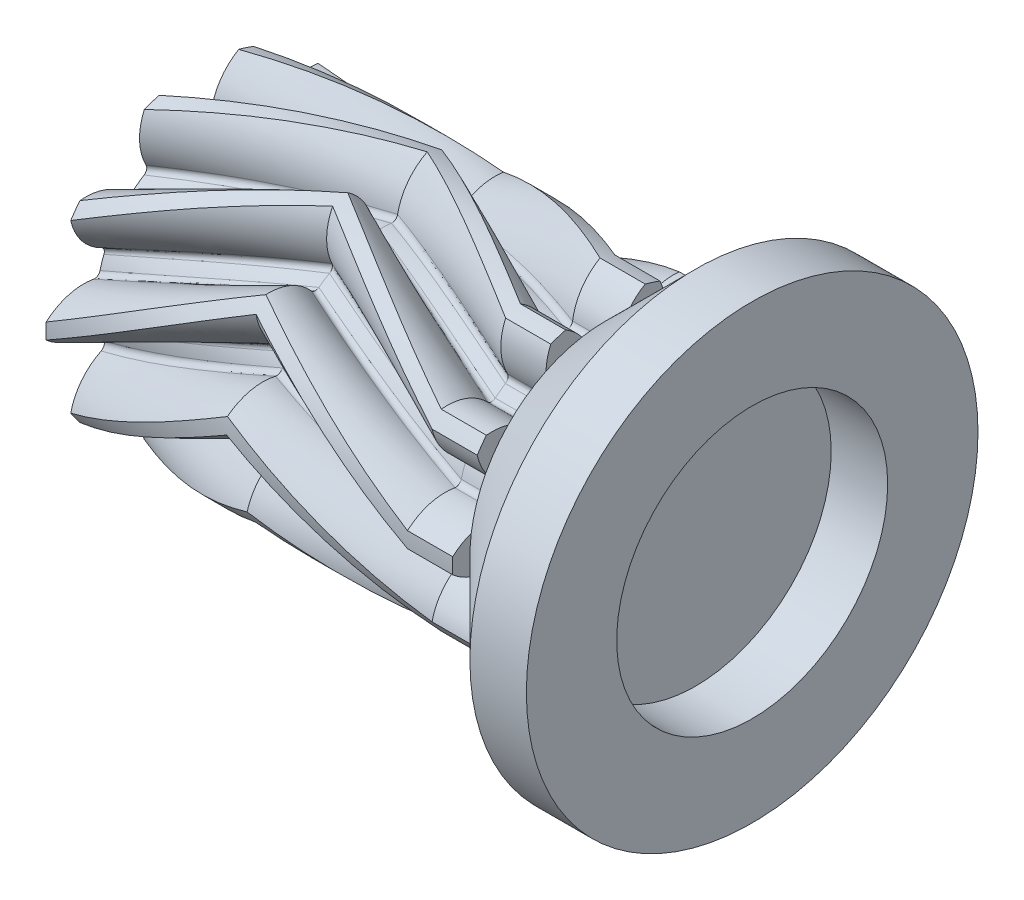
from build123d import *

# Parameters (mm, degrees)
BASPROSKE_W            = 4
BASPROSKE_H            = 3.386751346
TOOTHCUTLH_PITCH       = 36.857324629
TOOTHCUTLH_HEIGHT      = 4
TOOTHCUTLH_RADIUS      = 3.386751346
TOOTHCUTLH_START_ANGLE = -90
TEETHCUTSLH_COUNT      = 10
TEETHCUTSLH_ANGLE      = 324
BORSKE_R               = 1.5
BORE_DEPTH             = 62.5000025
BOSS_EXTRUDE2_DEPTH    = 8
BOSS_EXTRUDE5_START    = 1
BOSS_EXTRUDE5_DEPTH    = 1
SKETCH5_R              = 3
BOSS_EXTRUDE3_DEPTH    = 2
BOSS_EXTRUDE3_DRAFT    = -45
SKETCH6_R              = 5
SKETCH6_R_2            = 3
BOSS_EXTRUDE4_DEPTH    = 1.25


with BuildPart() as part:
    # BasProSke → Base-Revolve (revolve)
    with BuildSketch(Plane(origin=(0, 0, 0), x_dir=(1, 0, 0), z_dir=(0, 1, 0)), mode=Mode.PRIVATE) as base_revolve_sk:
        with Locations((2, 1.693375673)):
            Rectangle(BASPROSKE_W, BASPROSKE_H)
    revolve(base_revolve_sk.sketch.rotate(Axis((-10, 0, 0), (1, 0, 0)), 180), axis=Axis((-10, 0, 0), (1, 0, 0)))

    # ToothCutLH: sweep along a helix
    with BuildLine() as toothcutlh_path:
        add(Helix(TOOTHCUTLH_PITCH, TOOTHCUTLH_HEIGHT, TOOTHCUTLH_RADIUS, center=(0, 0, 0), direction=(1, 0, 0), lefthand=True, mode=Mode.PRIVATE).rotate(Axis((0, 0, 0), (1, 0, 0)), TOOTHCUTLH_START_ANGLE))
    # TooCutSkeRH<3> → ToothCutLH (sweep, cut)
    with BuildSketch(Plane(origin=(0, 0, 0), x_dir=(0, 0, -1), z_dir=(1, 0, 0))):
        with BuildLine():
            ThreePointArc((0.140530227, 2.257381316), (0, 2.261751346), (-0.140530227, 2.257381316))
            ThreePointArc((-0.140530227, 2.257381316), (-0.227997567, 2.28549718), (-0.273122261, 2.365527171))
            ThreePointArc((-0.273122261, 2.365527171), (-0.516553633, 2.94835954), (-1.013858929, 3.337769151))
            ThreePointArc((-1.013858929, 3.337769151), (0, 3.488353886), (1.013858929, 3.337769151))
            ThreePointArc((1.013858929, 3.337769151), (0.516553633, 2.94835954), (0.273122261, 2.365527171))
            ThreePointArc((0.273122261, 2.365527171), (0.227997567, 2.28549718), (0.140530227, 2.257381316))
        make_face()
    toothcutlh = sweep(path=toothcutlh_path.line, is_frenet=True, mode=Mode.SUBTRACT)

    # TeethCutsLH: ToothCutLH ×10 about axis
    teethcutslh_axis = Axis((-10, 0, 0), (1, 0, 0))
    for i in range(1, TEETHCUTSLH_COUNT):
        add(toothcutlh.rotate(teethcutslh_axis, i * TEETHCUTSLH_ANGLE / (TEETHCUTSLH_COUNT - 1)), mode=Mode.SUBTRACT)

    # BorSke → Bore (cut, symmetric)
    with BuildSketch(Plane(origin=(0, 0, 0), x_dir=(0, 0, -1), z_dir=(1, 0, 0))):
        with Locations(Location((0, 0, 0), (0, 0, 180))):
            Circle(BORSKE_R)
    extrude(amount=BORE_DEPTH, both=True, mode=Mode.SUBTRACT)

    # Mirror2: part across plane


with BuildPart() as part_1:
    add(part.part)
    add(part.part.mirror(Plane.ZY.offset(-4)))

    # Sketch4 → Boss-Extrude2 (add)
    with BuildSketch(Plane(origin=(8, 0, 0), x_dir=(0, 0, -1), z_dir=(1, 0, 0))):
        with BuildLine():
            ThreePointArc((-0.693912794, -1.329843989), (1.022484672, -1.097508586), (1.375569242, 0.598171599))
            Line((1.375569242, 0.598171599), (-0.693912794, -1.329843989))
        make_face()
        with BuildLine():
            Line((-1.375569242, -0.598171599), (0.693912794, 1.329843989))
            ThreePointArc((0.693912794, 1.329843989), (-1.022484672, 1.097508586), (-1.375569242, -0.598171599))
        make_face()
    extrude(amount=-BOSS_EXTRUDE2_DEPTH)

    # Sketch7 → Boss-Extrude5 (add)
    with BuildSketch(Plane(origin=(8, 0, 0), x_dir=(0, 0, -1), z_dir=(1, 0, 0)).offset(BOSS_EXTRUDE5_START)):
        with BuildLine():
            ThreePointArc((1.440546788, 1.743658253), (1.527835443, 1.714992452), (1.611382535, 1.753214445))
            ThreePointArc((1.611382535, 1.753214445), (2.079987729, 2.058046353), (2.634606237, 2.128129379))
            ThreePointArc((2.634606237, 2.128129379), (2.739939395, 1.990682494), (2.838109414, 1.848031285))
            ThreePointArc((2.838109414, 1.848031285), (2.600069952, 1.342214585), (2.16535061, 0.990742802))
            ThreePointArc((2.16535061, 0.990742802), (2.103181863, 0.923096041), (2.103470982, 0.831221377))
            ThreePointArc((2.103470982, 0.831221377), (2.151053356, 0.698919603), (2.190323439, 0.563917002))
            ThreePointArc((2.190323439, 0.563917002), (2.244092109, 0.489418897), (2.334149451, 0.471233391))
            ThreePointArc((2.334149451, 0.471233391), (2.892434716, 0.442408363), (3.382324283, 0.173110142))
            ThreePointArc((3.382324283, 0.173110142), (3.386751346, 0), (3.382324283, -0.173110142))
            ThreePointArc((3.382324283, -0.173110142), (2.892434716, -0.442408363), (2.334149451, -0.471233391))
            ThreePointArc((2.334149451, -0.471233391), (2.244092109, -0.489418897), (2.190323439, -0.563917002))
            ThreePointArc((2.190323439, -0.563917002), (2.151053356, -0.698919603), (2.103470982, -0.831221377))
            ThreePointArc((2.103470982, -0.831221377), (2.103181863, -0.923096041), (2.16535061, -0.990742802))
            ThreePointArc((2.16535061, -0.990742802), (2.600069952, -1.342214585), (2.838109414, -1.848031285))
            ThreePointArc((2.838109414, -1.848031285), (2.739939395, -1.990682494), (2.634606237, -2.128129379))
            ThreePointArc((2.634606237, -2.128129379), (2.079987729, -2.058046353), (1.611382535, -1.753214445))
            ThreePointArc((1.611382535, -1.753214445), (1.527835443, -1.714992452), (1.440546788, -1.743658253))
            ThreePointArc((1.440546788, -1.743658253), (1.329424086, -1.829795276), (1.213164105, -1.908861442))
            ThreePointArc((1.213164105, -1.908861442), (1.15892763, -1.983019667), (1.169461435, -2.074288919))
            ThreePointArc((1.169461435, -2.074288919), (1.314566839, -2.614157182), (1.209833213, -3.163287574))
            ThreePointArc((1.209833213, -3.163287574), (1.046563722, -3.220991937), (0.880558155, -3.270275526))
            ThreePointArc((0.880558155, -3.270275526), (0.473056126, -2.887580587), (0.273122261, -2.365527171))
            ThreePointArc((0.273122261, -2.365527171), (0.227997567, -2.28549718), (0.140530227, -2.257381316))
            ThreePointArc((0.140530227, -2.257381316), (0, -2.261751346), (-0.140530227, -2.257381316))
            ThreePointArc((-0.140530227, -2.257381316), (-0.227997567, -2.28549718), (-0.273122261, -2.365527171))
            ThreePointArc((-0.273122261, -2.365527171), (-0.473056126, -2.887580587), (-0.880558155, -3.270275526))
            ThreePointArc((-0.880558155, -3.270275526), (-1.046563722, -3.220991937), (-1.209833213, -3.163287574))
            ThreePointArc((-1.209833213, -3.163287574), (-1.314566839, -2.614157182), (-1.169461435, -2.074288919))
            ThreePointArc((-1.169461435, -2.074288919), (-1.15892763, -1.983019667), (-1.213164105, -1.908861442))
            ThreePointArc((-1.213164105, -1.908861442), (-1.329424086, -1.829795276), (-1.440546788, -1.743658253))
            ThreePointArc((-1.440546788, -1.743658253), (-1.527835443, -1.714992452), (-1.611382535, -1.753214445))
            ThreePointArc((-1.611382535, -1.753214445), (-2.079987729, -2.058046353), (-2.634606237, -2.128129379))
            ThreePointArc((-2.634606237, -2.128129379), (-2.739939395, -1.990682494), (-2.838109414, -1.848031285))
            ThreePointArc((-2.838109414, -1.848031285), (-2.600069952, -1.342214585), (-2.16535061, -0.990742802))
            ThreePointArc((-2.16535061, -0.990742802), (-2.103181863, -0.923096041), (-2.103470982, -0.831221377))
            ThreePointArc((-2.103470982, -0.831221377), (-2.151053356, -0.698919603), (-2.190323439, -0.563917002))
            ThreePointArc((-2.190323439, -0.563917002), (-2.244092109, -0.489418897), (-2.334149451, -0.471233391))
            ThreePointArc((-2.334149451, -0.471233391), (-2.892434716, -0.442408363), (-3.382324283, -0.173110142))
            ThreePointArc((-3.382324283, -0.173110142), (-3.386751346, 0), (-3.382324283, 0.173110142))
            ThreePointArc((-3.382324283, 0.173110142), (-2.892434716, 0.442408363), (-2.334149451, 0.471233391))
            ThreePointArc((-2.334149451, 0.471233391), (-2.244092109, 0.489418897), (-2.190323439, 0.563917002))
            ThreePointArc((-2.190323439, 0.563917002), (-2.151053356, 0.698919603), (-2.103470982, 0.831221377))
            ThreePointArc((-2.103470982, 0.831221377), (-2.103181863, 0.923096041), (-2.16535061, 0.990742802))
            ThreePointArc((-2.16535061, 0.990742802), (-2.600069952, 1.342214585), (-2.838109414, 1.848031285))
            ThreePointArc((-2.838109414, 1.848031285), (-2.739939395, 1.990682494), (-2.634606237, 2.128129379))
            ThreePointArc((-2.634606237, 2.128129379), (-2.079987729, 2.058046353), (-1.611382535, 1.753214445))
            ThreePointArc((-1.611382535, 1.753214445), (-1.527835443, 1.714992452), (-1.440546788, 1.743658253))
            ThreePointArc((-1.440546788, 1.743658253), (-1.329424086, 1.829795276), (-1.213164105, 1.908861442))
            ThreePointArc((-1.213164105, 1.908861442), (-1.15892763, 1.983019667), (-1.169461435, 2.074288919))
            ThreePointArc((-1.169461435, 2.074288919), (-1.314566839, 2.614157182), (-1.209833213, 3.163287574))
            ThreePointArc((-1.209833213, 3.163287574), (-1.046563722, 3.220991937), (-0.880558155, 3.270275526))
            ThreePointArc((-0.880558155, 3.270275526), (-0.473056126, 2.887580587), (-0.273122261, 2.365527171))
            ThreePointArc((-0.273122261, 2.365527171), (-0.227997567, 2.28549718), (-0.140530227, 2.257381316))
            ThreePointArc((-0.140530227, 2.257381316), (0, 2.261751346), (0.140530227, 2.257381316))
            ThreePointArc((0.140530227, 2.257381316), (0.227997567, 2.28549718), (0.273122261, 2.365527171))
            ThreePointArc((0.273122261, 2.365527171), (0.473056126, 2.887580587), (0.880558155, 3.270275526))
            ThreePointArc((0.880558155, 3.270275526), (1.046563722, 3.220991937), (1.209833213, 3.163287574))
            ThreePointArc((1.209833213, 3.163287574), (1.314566839, 2.614157182), (1.169461435, 2.074288919))
            ThreePointArc((1.169461435, 2.074288919), (1.15892763, 1.983019667), (1.213164105, 1.908861442))
            ThreePointArc((1.213164105, 1.908861442), (1.329424086, 1.829795276), (1.440546788, 1.743658253))
        make_face()
    extrude(amount=-BOSS_EXTRUDE5_DEPTH)


with BuildPart() as boss_extrude3_tool:
    # Sketch5 → Boss-Extrude3 (with draft: the straight prism first)
    with BuildSketch(Plane(origin=(9, 0, 0), x_dir=(0, 0, -1), z_dir=(1, 0, 0))):
        Circle(SKETCH5_R)
    extrude(amount=BOSS_EXTRUDE3_DEPTH)
    # Boss-Extrude3: the draft: its side faces are tilted about the plane it starts from
    boss_extrude3_sides = [boss_extrude3_tool.faces().sort_by_distance(p)[0] for p in [
        (10, 0, 3),
    ]]
    draft(boss_extrude3_sides, Plane(origin=(9, 0, 0), x_dir=(0, 0, -1), z_dir=(1, 0, 0)), BOSS_EXTRUDE3_DRAFT)


with BuildPart() as part_2:
    add(part_1.part)

    # Boss-Extrude3: add boss_extrude3_tool
    add(boss_extrude3_tool.part)

    # Sketch6 → Boss-Extrude4 (add)
    with BuildSketch(Plane(origin=(11, 0, 0), x_dir=(0, 0, -1), z_dir=(1, 0, 0))):
        Circle(SKETCH6_R)
        Circle(SKETCH6_R_2, mode=Mode.SUBTRACT)
    extrude(amount=BOSS_EXTRUDE4_DEPTH)


solid = part_2.part
